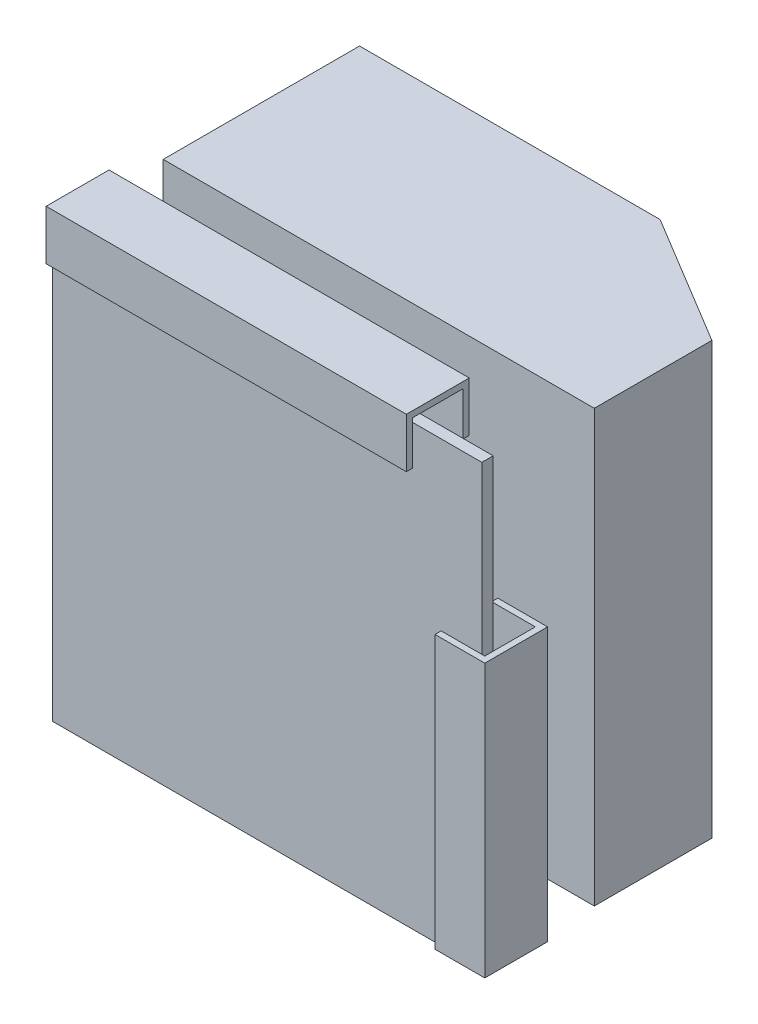
from build123d import *

# Parameters (mm, degrees)
HOUSING_DEPTH      = 55
DIFFUSER_SKETCH_W  = 109.6
DIFFUSER_SKETCH_H  = 112
DIFFUSER_DEPTH     = 1.45
SIDE_CHANNEL_DEPTH = 34.785
END_CHANNEL_DEPTH  = 45.96


with BuildPart() as part:
    # housing sketch → housing (new, symmetric)
    with BuildSketch(Plane(origin=(0, -55, 0), x_dir=(1, 0, 0), z_dir=(0, 1, 0))):
        Polygon((0, 0), (0, 30), (-33.304654329, 50.1), (-110, 50.1), (-110, 0), align=None)
    extrude(amount=HOUSING_DEPTH, both=True)


with BuildPart() as body_2:
    # diffuser sketch → diffuser (new, symmetric)
    with BuildSketch(Plane.XY.offset(26.85)):
        with Locations((-55.2, -54)):
            Rectangle(DIFFUSER_SKETCH_W, DIFFUSER_SKETCH_H)
    extrude(amount=DIFFUSER_DEPTH, both=True)

    # side channel sketch → side channel (add, symmetric)
    with BuildSketch(Plane(origin=(0, -75.215, 0), x_dir=(1, 0, 0), z_dir=(0, 1, 0))):
        Polygon((-10.78, -13.83), (1.92, -13.83), (1.92, -29.87), (-10.78, -29.87), (-10.78, -28.3), (0.35, -28.3), (0.35, -15.4), (-10.78, -15.4), align=None)
    extrude(amount=SIDE_CHANNEL_DEPTH, both=True)

    # end channel sketch → end channel (add, symmetric)
    with BuildSketch(Plane(origin=(-64.04, 0, 0), x_dir=(0, 0, -1), z_dir=(1, 0, 0))):
        Polygon((-13.83, -8.13), (-13.83, 4.57), (-29.87, 4.57), (-29.87, -8.13), (-28.3, -8.13), (-28.3, 3), (-15.4, 3), (-15.4, -8.13), align=None)
    extrude(amount=END_CHANNEL_DEPTH, both=True)


solid = Compound([part.part, body_2.part])
